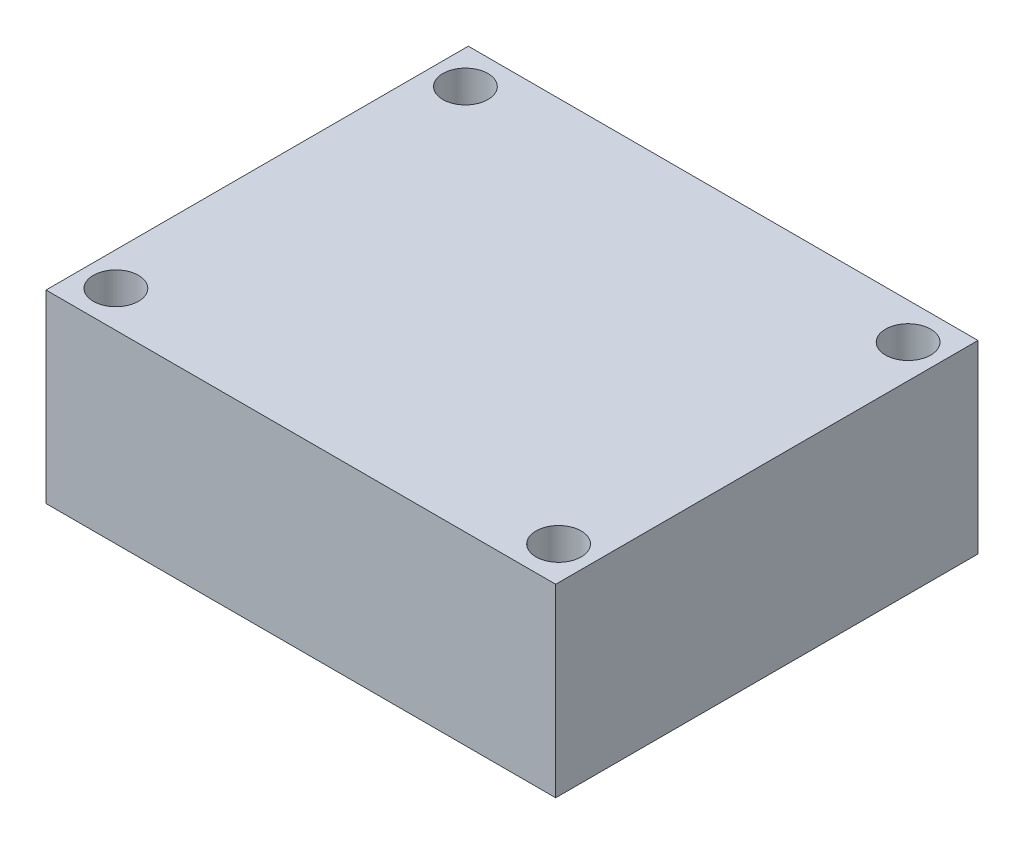
from build123d import *

# Parameters (mm, degrees)
SKETCH1_W           = 35
SKETCH1_H           = 29
SKETCH1_R           = 1.55
BOSS_EXTRUDE1_DEPTH = 12.7


with BuildPart() as part:
    # Sketch1 → Boss-Extrude1 (new body)
    with BuildSketch(Plane(origin=(0, 0, 0), x_dir=(1, 0, 0), z_dir=(0, 1, 0))):
        Rectangle(SKETCH1_W, SKETCH1_H)
        with Locations((-15.2, 12)):
            Circle(SKETCH1_R, mode=Mode.SUBTRACT)
        with Locations((15.2, 12)):
            Circle(SKETCH1_R, mode=Mode.SUBTRACT)
        with Locations((-15.2, -12)):
            Circle(SKETCH1_R, mode=Mode.SUBTRACT)
        with Locations((15.2, -12)):
            Circle(SKETCH1_R, mode=Mode.SUBTRACT)
    extrude(amount=BOSS_EXTRUDE1_DEPTH)


solid = part.part
